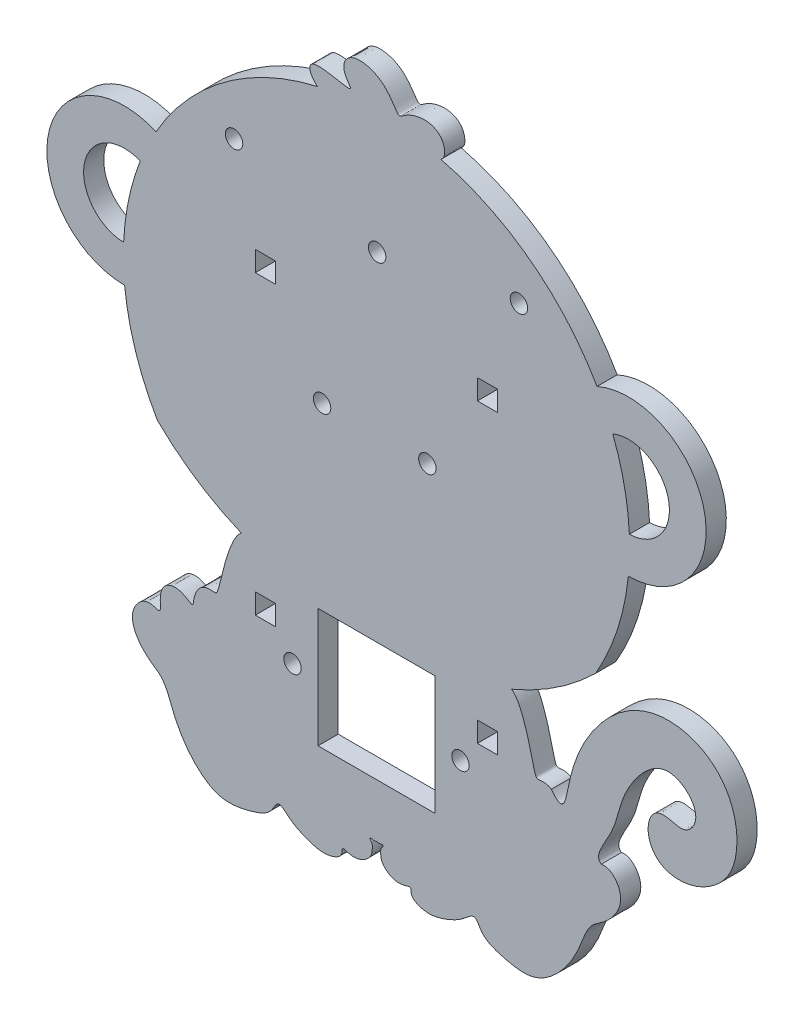
from build123d import *

# Parameters (mm, degrees)
MODEL_R             = 2.05
MODEL_W             = 4.75
MODEL_H             = 4.75
MODEL_W_2           = 27.5
MODEL_H_2           = 28
BOSS_EXTRUDE1_DEPTH = 4.75


with BuildPart() as part:
    # Model → Boss-Extrude1 (new body)
    with BuildSketch(Plane.XY):
        with BuildLine():
            ThreePointArc((-295.53920269, 433.095020448), (-277.643269068, 455.12113969), (-302.913653982, 468.037099404))
            ThreePointArc((-302.913653982, 468.037099404), (-318.490243046, 485.80537303), (-339.811140885, 495.991686882))
            add(Edge.make_bspline(
                [(-368.648535438, 496.252173352), (-368.744458236, 496.318852064), (-368.933155722, 496.46135137), (-369.206763211, 496.702529524), (-369.552638711, 497.078952875), (-369.945448044, 497.635151945), (-370.27396009, 498.258937778), (-370.49029081, 498.914952019), (-370.51070775, 499.541563445), (-370.238365938, 500.064302422), (-369.5990972, 500.417471707), (-368.57162488, 500.562380095), (-367.22355688, 500.508813977), (-365.687080465, 500.304348965), (-364.130399482, 500.021394498), (-362.730437113, 499.744991582), (-361.645780778, 499.560560003), (-360.987783845, 499.541133492), (-360.796409046, 499.736067669), (-361.003653893, 500.155847055), (-361.456239643, 500.775355547), (-361.969645158, 501.546412025), (-362.368346783, 502.406968262), (-362.540769792, 503.292531993), (-362.454363932, 504.143316727), (-362.127001431, 504.906996063), (-361.609010526, 505.54285956), (-360.962354705, 506.024792223), (-360.237689537, 506.346315269), (-359.465109655, 506.519028644), (-358.662050204, 506.563781119), (-357.836770513, 506.503364206), (-356.993360104, 506.355416269), (-356.136711355, 506.123246396), (-355.27524615, 505.794703449), (-354.419874931, 505.352916652), (-353.583850229, 504.783872945), (-352.782377599, 504.085819177), (-352.032065864, 503.276653785), (-351.351103862, 502.405268117), (-350.756796891, 501.550400765), (-350.259062752, 500.800910062), (-349.854900796, 500.240489256), (-349.52240587, 499.930593307), (-349.215031159, 499.894076524), (-348.855526802, 500.098537748), (-348.362085472, 500.475509867), (-347.67170771, 500.938251599), (-346.770031422, 501.402187782), (-345.688786994, 501.792289415), (-344.48987856, 502.045099565), (-343.253856136, 502.112491058), (-342.066559862, 501.964757688), (-341.006667622, 501.593968073), (-340.132609258, 501.01739116), (-339.470394525, 500.280534755), (-339.021946768, 499.447136213), (-338.772548612, 498.589873373), (-338.698846344, 497.780410896), (-338.775989921, 497.080683391), (-338.986639614, 496.531262609), (-339.255348506, 496.227388525), (-339.511863577, 496.0787419), (-339.707309513, 496.014838841), (-339.811140885, 495.991686882)],
                knots=[0, 0, 0, 0, 0, 0, 0.016666667, 0.033333333, 0.05, 0.066666667, 0.083333333, 0.1, 0.116666667, 0.133333333, 0.15, 0.166666667, 0.183333333, 0.2, 0.216666667, 0.233333333, 0.25, 0.266666667, 0.283333333, 0.3, 0.316666667, 0.333333333, 0.35, 0.366666667, 0.383333333, 0.4, 0.416666667, 0.433333333, 0.45, 0.466666667, 0.483333333, 0.5, 0.516666667, 0.533333333, 0.55, 0.566666667, 0.583333333, 0.6, 0.616666667, 0.633333333, 0.65, 0.666666667, 0.683333333, 0.7, 0.716666667, 0.733333333, 0.75, 0.766666667, 0.783333333, 0.8, 0.816666667, 0.833333333, 0.85, 0.866666667, 0.883333333, 0.9, 0.916666667, 0.933333333, 0.95, 0.966666667, 0.983333333, 1, 1, 1, 1, 1, 1], degree=5))
            ThreePointArc((-368.648535438, 496.252173352), (-390.614540969, 486.143224047), (-406.641533995, 468.037099404))
            ThreePointArc((-406.641533995, 468.037099404), (-431.911918909, 455.12113969), (-414.015985287, 433.095020448))
            ThreePointArc((-414.015985287, 433.095020448), (-411.431056442, 420.844790734), (-406.306877408, 409.421447336))
            ThreePointArc((-406.306877408, 409.421447336), (-397.05642145, 401.927835806), (-386.551251239, 396.327251189))
            add(Edge.make_bspline(
                [(-386.551251239, 396.327251189), (-386.916052394, 396.079204413), (-387.365984237, 395.634433922), (-387.896797281, 394.898644088), (-388.503330161, 393.757203334), (-389.171452603, 392.131003368), (-389.577925954, 391.014654975), (-389.970270784, 389.819275468), (-390.419319319, 388.323421516), (-390.83332726, 386.804935246), (-391.201587088, 385.34636593), (-391.516679205, 384.035346949), (-391.781698399, 382.944281063), (-391.975355466, 382.209449772), (-392.15403089, 381.664820315), (-392.336737386, 381.31109681), (-392.551498562, 381.129911234), (-392.833479669, 381.082225409), (-393.211479982, 381.115525432), (-393.693425125, 381.169472404), (-394.261194431, 381.182617586), (-394.881047474, 381.099420015), (-395.510435114, 380.877573231), (-396.105936728, 380.494485307), (-396.631517428, 379.95585235), (-397.063963964, 379.297531395), (-397.39210439, 378.573969962), (-397.617276013, 377.849585475), (-397.753517497, 377.188797135), (-397.82736951, 376.647023839), (-397.879059879, 376.260334721), (-397.959633552, 376.038465419), (-398.114782848, 375.972462073), (-398.366034123, 376.040823891), (-398.706936261, 376.21469148), (-399.120091801, 376.460086445), (-399.591458011, 376.741171495), (-400.117952431, 377.022315753), (-400.699774201, 377.268862798), (-401.463798734, 377.484035353), (-402.300244633, 377.553822048), (-403.174091852, 377.426716269), (-404.002173047, 377.065864722), (-404.698224792, 376.46441147), (-405.153470998, 375.811835942), (-405.461269956, 375.032169593), (-405.619922332, 374.166940367), (-405.657953521, 373.27889911), (-405.626485489, 372.442499072), (-405.587522811, 371.731075977), (-405.603727217, 371.205296174), (-405.727364814, 370.900755869), (-405.990085682, 370.81668236), (-406.39105056, 370.902146782), (-406.905602715, 371.07475403), (-407.496249881, 371.243305804), (-408.122207542, 371.327500075), (-408.751072773, 371.282728006), (-409.35960202, 371.097539496), (-409.931191749, 370.782809916), (-410.454421679, 370.36348433), (-410.921225043, 369.869653892), (-411.325051593, 369.32694511), (-411.659572418, 368.750331411), (-411.919102239, 368.147846593), (-412.098696202, 367.522400938), (-412.194371621, 366.874422897), (-412.203287138, 366.20397783), (-412.092164868, 365.237355517), (-411.795780763, 364.240492853), (-411.25356719, 363.0979097), (-410.505546493, 362.004000685), (-409.628552466, 361.020862692), (-408.940714048, 360.363039305), (-408.261699769, 359.795455705), (-407.719269628, 359.383631865), (-407.21381394, 359.028246689), (-406.753242924, 358.71792316), (-406.337217025, 358.432587935), (-405.958407604, 358.146100067), (-405.606436892, 357.832150323), (-405.270933307, 357.469037169), (-404.945150571, 357.045248498), (-404.628769556, 356.563710073), (-404.325203667, 356.036561227), (-404.039420225, 355.480831591), (-403.775511082, 354.913678765), (-403.486293011, 354.234906798), (-403.22438966, 353.563780813), (-402.971971356, 352.893055429), (-402.704512752, 352.203026621), (-402.401681187, 351.478012783), (-402.062584898, 350.721085445), (-401.674639208, 349.927966936), (-401.239024686, 349.111007443), (-400.763113802, 348.289788183), (-400.254340005, 347.481959495), (-399.722634495, 346.692998852), (-399.163365939, 345.932140679), (-398.574323946, 345.19923963), (-397.949478676, 344.488835597), (-397.28186749, 343.797089708), (-396.693729261, 343.232918759), (-395.94666487, 342.573889335), (-395.145878925, 341.947793479), (-394.290902186, 341.375211916), (-393.384167186, 340.882126765), (-392.430043668, 340.491703263), (-391.606002687, 340.243986907), (-390.756002743, 340.079446261), (-389.883129061, 339.998262902), (-388.990604918, 339.995014447), (-388.082210988, 340.060658996), (-387.162607569, 340.183979577), (-386.237707408, 340.353267946), (-385.315001235, 340.557855636), (-384.403963907, 340.789827334), (-383.516286063, 341.045384095), (-382.66652457, 341.327024633), (-381.871318875, 341.642937555), (-381.146754324, 342.002777686), (-380.506140062, 342.414272763), (-379.957720387, 342.879646699), (-379.50217975, 343.391768319), (-379.130782998, 343.931240964), (-378.821858803, 344.461005534), (-378.544703377, 344.932108886), (-378.267774642, 345.29593373), (-377.965518245, 345.51436395), (-377.625879138, 345.570992742), (-377.257148561, 345.481328236), (-376.875804119, 345.278776475), (-376.496250149, 345.00253689), (-376.11706805, 344.682307942), (-375.720845967, 344.335154988), (-375.283150649, 343.970625574), (-374.779103973, 343.593551859), (-374.190278948, 343.207542556), (-373.377688666, 342.741091189), (-372.449841911, 342.284943077), (-371.448923671, 341.861784637), (-370.434447105, 341.496921291), (-369.457107924, 341.211628122), (-368.685864943, 341.035221995), (-367.964373903, 340.924859402), (-367.285516994, 340.881136877), (-366.635919607, 340.902071878), (-366.001452121, 340.984188477), (-365.373937537, 341.123915256), (-364.75630659, 341.318535957), (-364.170945702, 341.568094094), (-363.657947564, 341.87428189), (-363.258368215, 342.235110671), (-362.999601239, 342.639822419), (-362.882834785, 343.065290294), (-362.862380856, 343.467877411), (-362.860328863, 343.794256059), (-362.800804618, 344.002021381), (-362.645316427, 344.082202864), (-362.403915174, 344.064482859), (-362.091030238, 343.983757423), (-361.712216892, 343.868949898), (-361.271123238, 343.746963048), (-360.772201451, 343.643387937), (-360.225145899, 343.584551667), (-359.643851104, 343.593953505), (-359.045609545, 343.68889199), (-358.331130904, 343.914571841), (-357.653031997, 344.271758954), (-357.055699253, 344.71601695), (-356.577458743, 345.17871164), (-356.233391408, 345.621031596), (-356.033125086, 345.975351534), (-355.902737419, 346.342883089), (-355.820827463, 346.757252518), (-355.769760706, 347.236551212), (-355.745106949, 347.759570584), (-355.762413964, 348.248781386), (-355.838587496, 348.623368474), (-355.977712536, 348.837568218), (-356.150848594, 348.941800594), (-356.292732028, 349.075710758), (-356.33646563, 349.288102762), (-356.236344626, 349.443149765), (-355.997125235, 349.455364951), (-355.677539018, 349.382302231), (-355.345578077, 349.318848286), (-355.1000792, 349.319880609), (-354.932396923, 349.356987082), (-354.827970147, 349.397996872), (-354.777593989, 349.422562594)],
                knots=[0, 0, 0, 0, 0, 0, 0.02, 0.025, 0.03, 0.035, 0.04, 0.045, 0.05, 0.06, 0.065, 0.07, 0.075, 0.08, 0.085, 0.09, 0.095, 0.1, 0.105, 0.11, 0.115, 0.12, 0.125, 0.13, 0.135, 0.14, 0.145, 0.15, 0.155, 0.16, 0.165, 0.17, 0.175, 0.18, 0.185, 0.19, 0.195, 0.2, 0.205, 0.21, 0.22, 0.225, 0.23, 0.235, 0.24, 0.245, 0.25, 0.255, 0.26, 0.265, 0.27, 0.275, 0.28, 0.285, 0.29, 0.295, 0.3, 0.305, 0.31, 0.315, 0.32, 0.325, 0.33, 0.335, 0.34, 0.345, 0.35, 0.355, 0.36, 0.375, 0.38, 0.39, 0.395, 0.4, 0.405, 0.41, 0.415, 0.42, 0.425, 0.43, 0.435, 0.44, 0.445, 0.45, 0.455, 0.46, 0.465, 0.47, 0.48, 0.485, 0.49, 0.495, 0.5, 0.51, 0.515, 0.52, 0.525, 0.53, 0.54, 0.545, 0.55, 0.555, 0.56, 0.565, 0.575, 0.58, 0.585, 0.59, 0.595, 0.6, 0.605, 0.61, 0.615, 0.62, 0.625, 0.63, 0.635, 0.64, 0.645, 0.65, 0.655, 0.66, 0.665, 0.67, 0.675, 0.68, 0.685, 0.69, 0.695, 0.7, 0.705, 0.71, 0.715, 0.72, 0.725, 0.73, 0.735, 0.74, 0.745, 0.755, 0.76, 0.765, 0.77, 0.775, 0.78, 0.785, 0.79, 0.795, 0.8, 0.805, 0.81, 0.815, 0.82, 0.825, 0.83, 0.835, 0.84, 0.845, 0.85, 0.855, 0.86, 0.865, 0.87, 0.875, 0.88, 0.885, 0.89, 0.895, 0.905, 0.91, 0.915, 0.92, 0.925, 0.93, 0.935, 0.94, 0.945, 0.95, 0.955, 0.96, 0.965, 0.97, 0.975, 0.98, 0.985, 0.99, 0.995, 1, 1, 1, 1, 1, 1], degree=5))
            add(Edge.make_bspline(
                [(-301.898947089, 371.249991702), (-301.80670497, 371.265018138), (-301.589974955, 371.293910279), (-301.244905456, 371.313674079), (-300.773941346, 371.273545454), (-300.195585957, 371.097539496), (-299.623996228, 370.782809916), (-299.100766299, 370.36348433), (-298.633962934, 369.869653892), (-298.230136384, 369.32694511), (-297.89561556, 368.750331411), (-297.636085738, 368.147846593), (-297.456491776, 367.522400938), (-297.360816357, 366.874422897), (-297.35190084, 366.20397783), (-297.463023109, 365.237355517), (-297.759407215, 364.240492853), (-298.301620787, 363.0979097), (-299.049641484, 362.004000685), (-299.926635511, 361.020862692), (-300.61447393, 360.363039305), (-301.293488209, 359.795455705), (-301.83591835, 359.383631865), (-302.341374037, 359.028246689), (-302.801945054, 358.71792316), (-303.217970952, 358.432587935), (-303.596780374, 358.146100067), (-303.948751085, 357.832150323), (-304.28425467, 357.469037169), (-304.610037406, 357.045248498), (-304.926418421, 356.563710073), (-305.22998431, 356.036561227), (-305.515767753, 355.480831591), (-305.779676896, 354.913678765), (-306.068894967, 354.234906798), (-306.330798317, 353.563780813), (-306.583216622, 352.893055429), (-306.850675225, 352.203026621), (-307.15350679, 351.478012783), (-307.492603079, 350.721085445), (-307.88054877, 349.927966936), (-308.316163291, 349.111007443), (-308.792074176, 348.289788183), (-309.300847972, 347.481959495), (-309.832553482, 346.692998852), (-310.391822039, 345.932140679), (-310.980864031, 345.19923963), (-311.605709301, 344.488835597), (-312.273320488, 343.797089708), (-312.861458716, 343.232918759), (-313.608523108, 342.573889335), (-314.409309053, 341.947793479), (-315.264285791, 341.375211916), (-316.171020791, 340.882126765), (-317.125144309, 340.491703263), (-317.949185291, 340.243986907), (-318.799185234, 340.079446261), (-319.672058916, 339.998262902), (-320.564583059, 339.995014447), (-321.472976989, 340.060658996), (-322.392580408, 340.183979577), (-323.31748057, 340.353267946), (-324.240186742, 340.557855636), (-325.151224071, 340.789827334), (-326.038901914, 341.045384095), (-326.888663407, 341.327024633), (-327.683869103, 341.642937555), (-328.408433654, 342.002777686), (-329.049047915, 342.414272763), (-329.59746759, 342.879646699), (-330.053008227, 343.391768319), (-330.42440498, 343.931240964), (-330.733329174, 344.461005534), (-331.0104846, 344.932108886), (-331.287413335, 345.29593373), (-331.589669732, 345.51436395), (-331.929308839, 345.570992742), (-332.298039416, 345.481328236), (-332.679383858, 345.278776475), (-333.058937829, 345.00253689), (-333.438119927, 344.682307942), (-333.83434201, 344.335154988), (-334.272037329, 343.970625574), (-334.776084004, 343.593551859), (-335.364909029, 343.207542556), (-336.177499311, 342.741091189), (-337.105346067, 342.284943077), (-338.106264306, 341.861784637), (-339.120740873, 341.496921291), (-340.098080053, 341.211628122), (-340.869323035, 341.035221995), (-341.590814074, 340.924859402), (-342.269670984, 340.881136877), (-342.91926837, 340.902071878), (-343.553735856, 340.984188477), (-344.18125044, 341.123915256), (-344.798881387, 341.318535957), (-345.384242276, 341.568094094), (-345.897240413, 341.87428189), (-346.296819762, 342.235110671), (-346.555586738, 342.639822419), (-346.672353193, 343.065290294), (-346.692807122, 343.467877411), (-346.694859114, 343.794256059), (-346.754383359, 344.002021381), (-346.909871551, 344.082202864), (-347.151272803, 344.064482859), (-347.46415774, 343.983757423), (-347.842971085, 343.868949898), (-348.284064739, 343.746963048), (-348.782986526, 343.643387937), (-349.330042079, 343.584551667), (-349.911336873, 343.593953505), (-350.509578433, 343.68889199), (-351.224057074, 343.914571841), (-351.902155981, 344.271758954), (-352.499488725, 344.71601695), (-352.977729235, 345.17871164), (-353.321796569, 345.621031596), (-353.522062892, 345.975351534), (-353.652450559, 346.342883089), (-353.734360514, 346.757252518), (-353.785427271, 347.236551212), (-353.810081029, 347.759570584), (-353.792774013, 348.248781386), (-353.716600481, 348.623368474), (-353.577475441, 348.837568218), (-353.404339383, 348.941800594), (-353.262455949, 349.075710758), (-353.218722348, 349.288102762), (-353.318843352, 349.443149765), (-353.558062742, 349.455364951), (-353.87764896, 349.382302231), (-354.2096099, 349.318848286), (-354.455108777, 349.319880609), (-354.622791055, 349.356987082), (-354.727217831, 349.397996872), (-354.777593989, 349.422562594)],
                knots=[0.291239622, 0.291239622, 0.291239622, 0.291239622, 0.291239622, 0.291239622, 0.295, 0.3, 0.305, 0.31, 0.315, 0.32, 0.325, 0.33, 0.335, 0.34, 0.345, 0.35, 0.355, 0.36, 0.375, 0.38, 0.39, 0.395, 0.4, 0.405, 0.41, 0.415, 0.42, 0.425, 0.43, 0.435, 0.44, 0.445, 0.45, 0.455, 0.46, 0.465, 0.47, 0.48, 0.485, 0.49, 0.495, 0.5, 0.51, 0.515, 0.52, 0.525, 0.53, 0.54, 0.545, 0.55, 0.555, 0.56, 0.565, 0.575, 0.58, 0.585, 0.59, 0.595, 0.6, 0.605, 0.61, 0.615, 0.62, 0.625, 0.63, 0.635, 0.64, 0.645, 0.65, 0.655, 0.66, 0.665, 0.67, 0.675, 0.68, 0.685, 0.69, 0.695, 0.7, 0.705, 0.71, 0.715, 0.72, 0.725, 0.73, 0.735, 0.74, 0.745, 0.755, 0.76, 0.765, 0.77, 0.775, 0.78, 0.785, 0.79, 0.795, 0.8, 0.805, 0.81, 0.815, 0.82, 0.825, 0.83, 0.835, 0.84, 0.845, 0.85, 0.855, 0.86, 0.865, 0.87, 0.875, 0.88, 0.885, 0.89, 0.895, 0.905, 0.91, 0.915, 0.92, 0.925, 0.93, 0.935, 0.94, 0.945, 0.95, 0.955, 0.96, 0.965, 0.97, 0.975, 0.98, 0.985, 0.99, 0.995, 1, 1, 1, 1, 1, 1], degree=5))
            add(Edge.make_bspline(
                [(-301.898947089, 371.249991702), (-302.03777992, 371.337842664), (-302.278358106, 371.535036125), (-302.527935786, 371.895313524), (-302.638326758, 372.504569396), (-302.422921716, 373.473093417), (-301.910810817, 374.622658725), (-301.203239072, 375.907021068), (-300.417430607, 377.272852531), (-299.663776374, 378.670412259), (-299.023340821, 380.063869225), (-298.518808306, 381.445147803), (-298.11469187, 382.832378816), (-297.742815902, 384.255163919), (-297.321372994, 385.743083541), (-296.774951218, 387.313965856), (-296.05819531, 388.959584105), (-295.162040147, 390.642897503), (-294.101045993, 392.307630147), (-292.906052001, 393.884476201), (-291.614267711, 395.298727975), (-290.261394711, 396.477163759), (-288.870633099, 397.355559995), (-287.450506474, 397.88487723), (-286.008600232, 398.034757091), (-284.562929688, 397.798008073), (-283.152043236, 397.193839546), (-281.851079655, 396.27377504), (-280.76403377, 395.118025382), (-279.993445178, 393.822748232), (-279.614594112, 392.489509944), (-279.651481692, 391.214486489), (-280.042701572, 390.076155472), (-280.672983329, 389.134306182), (-281.424791372, 388.432592409), (-282.224227316, 388.000042889), (-283.086509475, 387.852497186), (-284.061898655, 387.966698541), (-285.187617596, 388.257647228), (-286.432799241, 388.549506411), (-287.714778317, 388.627521421), (-288.922339625, 388.299673225), (-289.935960884, 387.451354667), (-290.650627543, 386.112012698), (-290.983205819, 384.420926362), (-290.877596402, 382.578851159), (-290.311010342, 380.803687119), (-289.299028152, 379.286710653), (-287.903220924, 378.142688713), (-286.219105708, 377.4170411), (-284.360670175, 377.103581142), (-282.445893609, 377.158636255), (-280.582328457, 377.516407907), (-278.851525965, 378.104383008), (-277.297305988, 378.856918007), (-275.93548394, 379.717384281), (-274.760882323, 380.641693853), (-273.755463023, 381.601444913), (-272.895776168, 382.586894991), (-272.161214125, 383.610945588), (-271.535866394, 384.70099922), (-271.009722971, 385.888830428), (-270.579877607, 387.201933377), (-270.252293644, 388.652401735), (-270.040978563, 390.2346489), (-269.965016257, 391.930118455), (-270.046205794, 393.710009769), (-270.306480744, 395.538773505), (-270.857132325, 397.745077765), (-271.727774145, 399.906931327), (-272.937052277, 401.94602382), (-274.485083983, 403.787796033), (-276.348901152, 405.366769995), (-278.092782759, 406.4785487), (-280.379149882, 407.539092006), (-283.265109328, 408.344541641), (-286.299006859, 408.594090842), (-289.32996603, 408.269637229), (-292.650761978, 407.269272218), (-295.374305071, 405.888080142), (-297.55376872, 404.384775694), (-299.570759796, 402.614165823), (-301.423227661, 400.629872898), (-302.855961089, 398.859622636), (-304.437971019, 396.623488316), (-305.836320205, 394.276384281), (-307.030109551, 391.853114628), (-308.001652746, 389.39378453), (-308.755268533, 386.963327702), (-309.250925564, 385.001542652), (-309.640561499, 383.162221439), (-309.968617434, 381.523898785), (-310.292721218, 380.178229359), (-310.673366326, 379.216827317), (-311.16584039, 378.72093299), (-311.809926861, 378.748147162), (-312.461695262, 379.21039337), (-313.030249288, 379.809050666), (-313.444699739, 380.320105618), (-313.6607794, 380.60362174)],
                knots=[0.011105874, 0.011105874, 0.011105874, 0.011105874, 0.011105874, 0.011105874, 0.021105874, 0.031105874, 0.041105874, 0.051105874, 0.061105874, 0.071105874, 0.081105874, 0.091105874, 0.101105874, 0.111105874, 0.121105874, 0.131105874, 0.141105874, 0.151105874, 0.161105874, 0.171105874, 0.181105874, 0.191105874, 0.201105874, 0.211105874, 0.221105874, 0.231105874, 0.241105874, 0.251105874, 0.261105874, 0.271105874, 0.281105874, 0.291105874, 0.301105874, 0.311105874, 0.321105874, 0.331105874, 0.341105874, 0.351105874, 0.361105874, 0.371105874, 0.381105874, 0.391105874, 0.401105874, 0.411105874, 0.421105874, 0.431105874, 0.441105874, 0.451105874, 0.461105874, 0.471105874, 0.481105874, 0.491105874, 0.501105874, 0.511105874, 0.521105874, 0.531105874, 0.541105874, 0.551105874, 0.561105874, 0.571105874, 0.581105874, 0.591105874, 0.601105874, 0.611105874, 0.621105874, 0.631105874, 0.641105874, 0.651105874, 0.661105874, 0.671105874, 0.681105874, 0.701105874, 0.711105874, 0.721105874, 0.731105874, 0.741105874, 0.751105874, 0.771105874, 0.791105874, 0.801105874, 0.811105874, 0.831105874, 0.841105874, 0.851105874, 0.861105874, 0.871105874, 0.881105874, 0.901105874, 0.911105874, 0.921105874, 0.931105874, 0.941105874, 0.951105874, 0.961105874, 0.971105874, 0.981105874, 0.991105874, 1.001105874, 1.011105874, 1.011105874, 1.011105874, 1.011105874, 1.011105874, 1.011105874], degree=5))
            add(Edge.make_bspline(
                [(-323.003936738, 396.327251189), (-322.639135583, 396.079204413), (-322.18920374, 395.634433922), (-321.658390696, 394.898644088), (-321.051857816, 393.757203334), (-320.383735374, 392.131003368), (-319.977262023, 391.014654975), (-319.584917193, 389.819275468), (-319.135868658, 388.323421516), (-318.721860717, 386.804935246), (-318.353600889, 385.34636593), (-318.038508773, 384.035346949), (-317.773489578, 382.944281063), (-317.579832511, 382.209449772), (-317.401157087, 381.664820315), (-317.218450591, 381.31109681), (-317.003689416, 381.129911234), (-316.721708308, 381.082225409), (-316.343707995, 381.115525432), (-315.861762853, 381.169472404), (-315.293993546, 381.182617586), (-314.716438841, 381.105097359), (-314.256472836, 380.951412883), (-313.932453608, 380.783648044), (-313.737120758, 380.657216991), (-313.6607794, 380.60362174)],
                knots=[0, 0, 0, 0, 0, 0, 0.02, 0.025, 0.03, 0.035, 0.04, 0.045, 0.05, 0.06, 0.065, 0.07, 0.075, 0.08, 0.085, 0.09, 0.095, 0.1, 0.105, 0.11, 0.115, 0.12, 0.123294018, 0.123294018, 0.123294018, 0.123294018, 0.123294018, 0.123294018], degree=5))
            ThreePointArc((-323.003936738, 396.327251189), (-312.498766528, 401.927835806), (-303.24831057, 409.421447336))
            ThreePointArc((-303.24831057, 409.421447336), (-298.124131535, 420.844790734), (-295.53920269, 433.095020448))
        make_face()
        with BuildLine():
            ThreePointArc((-295.302245857, 441.734311673), (-296.504545624, 451.140507471), (-299.205795948, 460.23035295))
            ThreePointArc((-299.205795948, 460.23035295), (-286.094272789, 453.337573366), (-295.302245857, 441.734311673))
        make_face(mode=Mode.SUBTRACT)
        with Locations((-321.277593989, 475.779236712)):
            Circle(MODEL_R, mode=Mode.SUBTRACT)
        with Locations((-367.578065783, 432.289888386)):
            Circle(MODEL_R, mode=Mode.SUBTRACT)
        with Locations((-380.902593989, 453.404236712)):
            Rectangle(MODEL_W, MODEL_H, mode=Mode.SUBTRACT)
        with Locations((-388.277593989, 475.779236712)):
            Circle(MODEL_R, mode=Mode.SUBTRACT)
        with Locations((-354.619244966, 469.543613637)):
            Circle(MODEL_R, mode=Mode.SUBTRACT)
        with Locations((-342.813199123, 432.371155303)):
            Circle(MODEL_R, mode=Mode.SUBTRACT)
        with Locations((-328.652593989, 453.404236712)):
            Rectangle(MODEL_W, MODEL_H, mode=Mode.SUBTRACT)
        with Locations((-328.652593989, 383.654236712)):
            Rectangle(MODEL_W, MODEL_H, mode=Mode.SUBTRACT)
        with Locations((-374.527593989, 375.779236712)):
            Circle(MODEL_R, mode=Mode.SUBTRACT)
        with Locations((-354.777593989, 376.029236712)):
            Rectangle(MODEL_W_2, MODEL_H_2, mode=Mode.SUBTRACT)
        with Locations((-380.902593989, 383.654236712)):
            Rectangle(MODEL_W, MODEL_H, mode=Mode.SUBTRACT)
        with Locations((-335.027593989, 375.779236712)):
            Circle(MODEL_R, mode=Mode.SUBTRACT)
        with BuildLine():
            ThreePointArc((-410.349392029, 460.23035295), (-413.050642353, 451.140507471), (-414.252942121, 441.734311673))
            ThreePointArc((-414.252942121, 441.734311673), (-423.460915188, 453.337573366), (-410.349392029, 460.23035295))
        make_face(mode=Mode.SUBTRACT)
    extrude(amount=BOSS_EXTRUDE1_DEPTH)


solid = part.part
